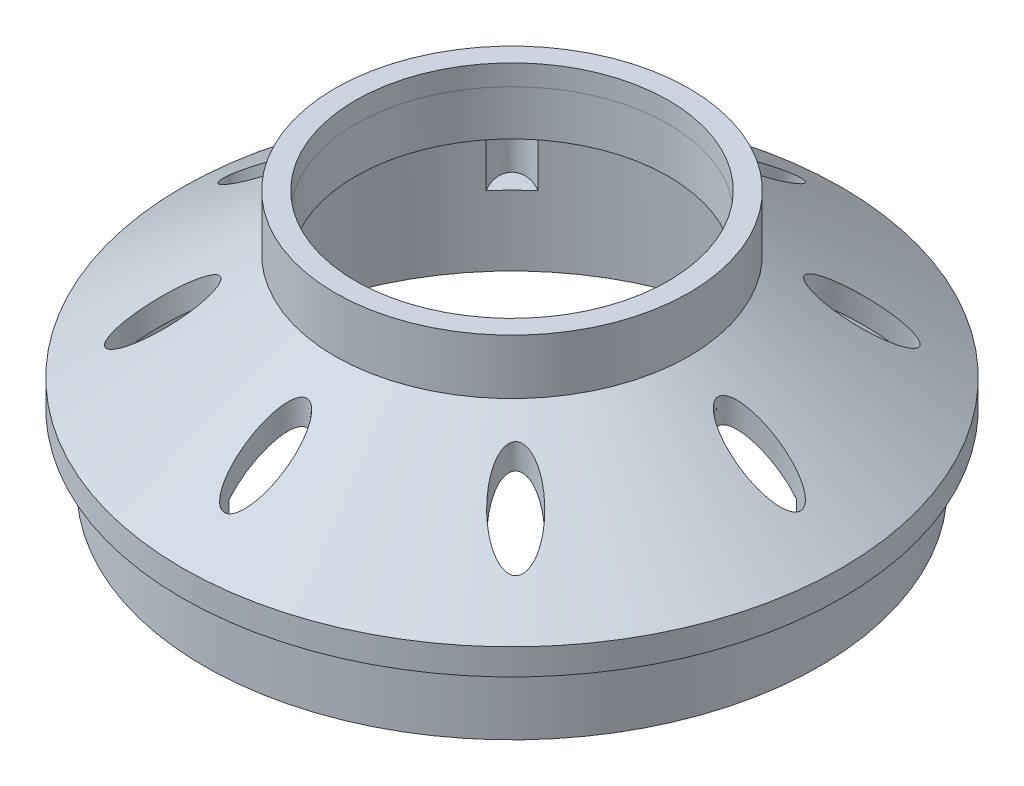
from build123d import *

# Parameters (mm, degrees)
CUT_EXTRUDE6_START     = 33.158480388
CUT_EXTRUDE6_OUTLINE_R = 11.4
CUT_EXTRUDE6_DEPTH     = 6
SKETCH4_RX             = 3
SKETCH4_RY             = 1.5
CUT_EXTRUDE8_DEPTH     = 10


with BuildPart() as part:
    # Sketch1 → Revolve5 (revolve)
    with BuildSketch(Plane.XY, mode=Mode.PRIVATE) as revolve5_sk:
        Polygon((12.83143618, 37.658480388), (12.83143618, 34.358480388), (20.850158422, 28.732399036), (20.850158422, 20.356663604), (23.851183277, 20.356663604), (23.851183277, 25.456663604), (25.451183277, 25.456663604), (25.451183277, 27.356663604), (14.331436179, 35.158480388), (14.331436179, 39.158480388), (1.431436179, 39.158480388), (1.431436179, 33.158480388), (2.93143618, 33.158480388), (2.93143618, 37.658480388), align=None)
    revolve(revolve5_sk.sketch.rotate(Axis((1.431436179, 33.158480388, 0), (0, 1, 0)), 90), axis=Axis((1.431436179, 33.158480388, 0), (0, 1, 0)))

    # Cut-Extrude6: read off the stored shape, not the designer's step
    # Cut-Extrude6 outline → Cut-Extrude6 (cut)
    with BuildSketch(Plane(origin=(0, 0, 0), x_dir=(1, 0, 0), z_dir=(0, 1, 0)).offset(CUT_EXTRUDE6_START)):
        with Locations((1.431436179, 0)):
            Circle(CUT_EXTRUDE6_OUTLINE_R)
    extrude(amount=CUT_EXTRUDE6_DEPTH, mode=Mode.SUBTRACT)

    # Sketch4 → Cut-Extrude8 (cut)
    with BuildSketch(Plane.XZ.offset(-25.456663604)):
        with Locations(Location((1.431436179, -18.019747097), (0, 0, 90))):
            Ellipse(SKETCH4_RX, SKETCH4_RY)
        with Locations(Location((1.546290764, 18.061259806), (0, 0, 90))):
            Ellipse(SKETCH4_RX, SKETCH4_RY)
        with Locations(Location((-11.310449188, -12.741885368), (0, 0, 45))):
            Ellipse(SKETCH4_RX, SKETCH4_RY)
        with Locations(Location((14.172625723, 12.4714761), (0, 0, 45))):
            Ellipse(SKETCH4_RX, SKETCH4_RY)
        with Locations(Location((14.173321547, -12.741885368), (0, 0, 135))):
            Ellipse(SKETCH4_RX, SKETCH4_RY)
        with Locations((19.451183277, 0)):
            Ellipse(SKETCH4_RX, SKETCH4_RY)
        with Locations(Location((-11.211568519, 12.800286906), (0, 0, 135))):
            Ellipse(SKETCH4_RX, SKETCH4_RY)
        with Locations((-16.53830358, 0.108189785)):
            Ellipse(SKETCH4_RX, SKETCH4_RY)
    extrude(amount=-CUT_EXTRUDE8_DEPTH, mode=Mode.SUBTRACT)


solid = part.part
